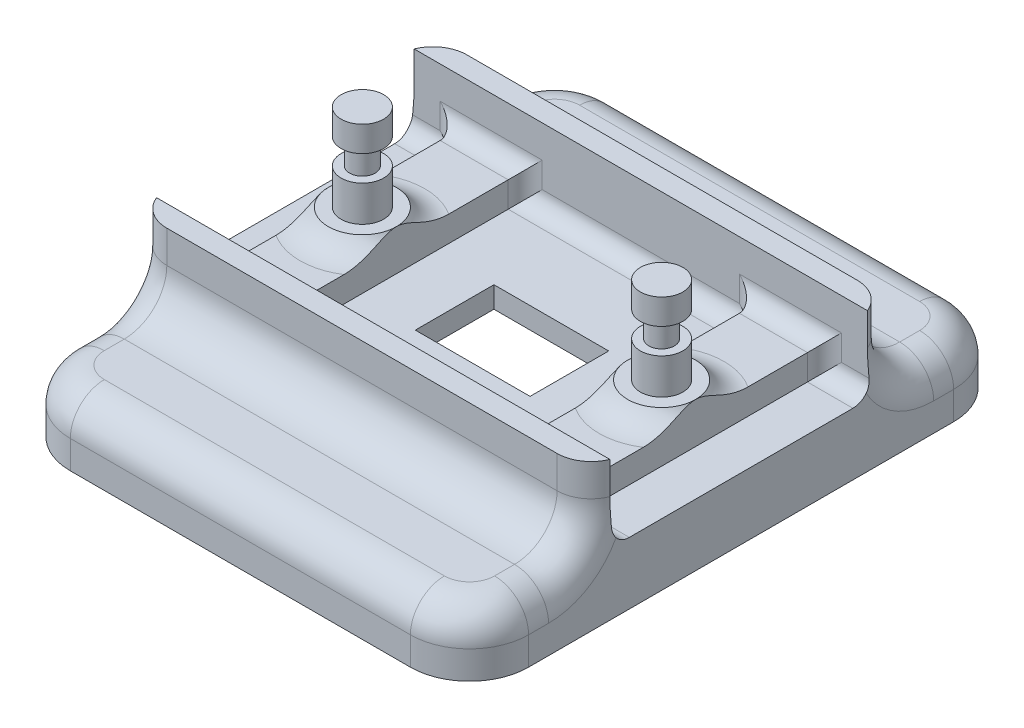
from build123d import *

# Parameters (mm, degrees)
SALIENTE_EXTRUIR1_DEPTH = 2.5
SALIENTE_EXTRUIR2_START = -4.8
SALIENTE_EXTRUIR2_DEPTH = 4.8
REDONDEO1_R             = 1
SALIENTE_EXTRUIR3_DEPTH = 8.8
CROQUIS3_3_R            = 4
CROQUIS3_3_R_2          = 1.625
SALIENTE_EXTRUIR6_DEPTH = 3
CROQUIS3_4_R            = 4
CROQUIS3_4_R_2          = 1.625
SALIENTE_EXTRUIR7_DEPTH = 4.8
REDONDEO2_R             = 2
REDONDEO3_R             = 5
REDONDEO4_R             = 4
REDONDEO5_R             = 4
CROQUIS4_R              = 2.5
SALIENTE_EXTRUIR8_DEPTH = 15
CORTAR_EXTRUIR1_START   = -6
CROQUIS5_R              = 2.5
CROQUIS5_R_2            = 1.5
CORTAR_EXTRUIR1_DEPTH   = 3
CROQUIS6_W              = 13.5
CROQUIS6_H              = 9.25
CORTAR_EXTRUIR2_DEPTH   = 45.408388908


with BuildPart() as part:
    # Croquis2 → Saliente-Extruir1 (new body)
    # profile 1 of 2: a face of its own
    with BuildSketch(Plane(origin=(0, 0, 0), x_dir=(1, 0, 0), z_dir=(0, 1, 0))):
        with BuildLine():
            Line((26.95, -25), (26.95, 25))
            ThreePointArc((26.95, 25), (24.914392129, 29.914392129), (20, 31.95))
            Line((20, 31.95), (-20, 31.95))
            ThreePointArc((-20, 31.95), (-24.914392129, 29.914392129), (-26.95, 25))
            Line((-26.95, 25), (-26.95, -25))
            ThreePointArc((-26.95, -25), (-24.914392129, -29.914392129), (-20, -31.95))
            Line((-20, -31.95), (20, -31.95))
            ThreePointArc((20, -31.95), (24.914392129, -29.914392129), (26.95, -25))
        make_face()
        with BuildLine():
            ThreePointArc((24.95, 25), (23.500178567, 28.500178567), (20, 29.95))
            Line((20, 29.95), (-20, 29.95))
            ThreePointArc((-20, 29.95), (-23.500178567, 28.500178567), (-24.95, 25))
            Line((-24.95, 25), (-24.95, -25))
            ThreePointArc((-24.95, -25), (-23.500178567, -28.500178567), (-20, -29.95))
            Line((-20, -29.95), (20, -29.95))
            ThreePointArc((20, -29.95), (23.500178567, -28.500178567), (24.95, -25))
            Line((24.95, -25), (24.95, 25))
        make_face(mode=Mode.SUBTRACT)
    # profile 2 of 2: a face of its own
    with BuildSketch(Plane(origin=(0, 0, 0), x_dir=(1, 0, 0), z_dir=(0, 1, 0))):
        with BuildLine():
            Line((24.95, -25), (24.95, 25))
            ThreePointArc((24.95, 25), (23.500178567, 28.500178567), (20, 29.95))
            Line((20, 29.95), (-20, 29.95))
            ThreePointArc((-20, 29.95), (-23.500178567, 28.500178567), (-24.95, 25))
            Line((-24.95, 25), (-24.95, -25))
            ThreePointArc((-24.95, -25), (-23.500178567, -28.500178567), (-20, -29.95))
            Line((-20, -29.95), (20, -29.95))
            ThreePointArc((20, -29.95), (23.500178567, -28.500178567), (24.95, -25))
        make_face()
    extrude(amount=SALIENTE_EXTRUIR1_DEPTH)

    # Croquis2<3> → Saliente-Extruir2 (add)
    with BuildSketch(Plane(origin=(0, 0, 0), x_dir=(1, 0, 0), z_dir=(0, 1, 0)).offset(SALIENTE_EXTRUIR2_START)):
        with BuildLine():
            Line((20, 31.95), (-20, 31.95))
            ThreePointArc((-20, 31.95), (-24.914392129, 29.914392129), (-26.95, 25))
            Line((-26.95, 25), (-26.95, -25))
            ThreePointArc((-26.95, -25), (-24.914392129, -29.914392129), (-20, -31.95))
            Line((-20, -31.95), (20, -31.95))
            ThreePointArc((20, -31.95), (24.914392129, -29.914392129), (26.95, -25))
            Line((26.95, -25), (26.95, 25))
            ThreePointArc((26.95, 25), (24.914392129, 29.914392129), (20, 31.95))
        make_face()
        with BuildLine():
            Line((20, 29.95), (-20, 29.95))
            ThreePointArc((-20, 29.95), (-23.500178567, 28.500178567), (-24.95, 25))
            Line((-24.95, 25), (-24.95, -25))
            ThreePointArc((-24.95, -25), (-23.500178567, -28.500178567), (-20, -29.95))
            Line((-20, -29.95), (20, -29.95))
            ThreePointArc((20, -29.95), (23.500178567, -28.500178567), (24.95, -25))
            Line((24.95, -25), (24.95, 25))
            ThreePointArc((24.95, 25), (23.500178567, 28.500178567), (20, 29.95))
        make_face(mode=Mode.SUBTRACT)
    extrude(amount=SALIENTE_EXTRUIR2_DEPTH)

    # Redondeo1
    redondeo1_edges = [part.edges().sort_by_distance(p)[0] for p in [
        (23.500178567, 0, -28.500178567),
        (24.95, 0, 0),
        (23.500178567, 0, 28.500178567),
        (0, 0, 29.95),
        (-23.500178567, 0, 28.500178567),
        (-24.95, 0, 0),
        (-23.500178567, 0, -28.500178567),
        (0, 0, -29.95),
    ]]
    fillet(redondeo1_edges, radius=REDONDEO1_R)

    # Croquis3 → Saliente-Extruir3 (add)
    with BuildSketch(Plane(origin=(0, 2.5, 0), x_dir=(1, 0, 0), z_dir=(0, 1, 0))):
        Polygon((-26.95, 17.65), (-26.95, 15.15), (-21.6, 15.15), (-13.6, 15.15), (13.6, 15.15), (21.6, 15.15), (26.95, 15.15), (26.95, 17.65), align=None)
        Polygon((-21.6, -15.15), (-26.95, -15.15), (-26.95, -17.65), (26.95, -17.65), (26.95, -15.15), (21.6, -15.15), (13.6, -15.15), (-13.6, -15.15), align=None)
    extrude(amount=SALIENTE_EXTRUIR3_DEPTH)

    # Croquis3<3> → Saliente-Extruir6 (add)
    # profile 1 of 6: a face of its own
    with BuildSketch(Plane(origin=(0, 2.5, 0), x_dir=(1, 0, 0), z_dir=(0, 1, 0))):
        with BuildLine():
            Line((-13.6, 15.15), (-21.6, 15.15))
            Line((-21.6, 15.15), (-21.6, -2.7e-08))
            ThreePointArc((-21.6, -2.7e-08), (-17.600000014, 4), (-13.6, 0))
            Line((-13.6, 0), (-13.6, 15.15))
        make_face()
    # profile 2 of 6: a face of its own
    with BuildSketch(Plane(origin=(0, 2.5, 0), x_dir=(1, 0, 0), z_dir=(0, 1, 0))):
        with BuildLine():
            Line((21.6, 15.15), (13.6, 15.15))
            Line((13.6, 15.15), (13.6, 0))
            ThreePointArc((13.6, 0), (17.6, 4), (21.6, 0))
            Line((21.6, 0), (21.6, 15.15))
        make_face()
    # profile 3 of 6: a face of its own
    with BuildSketch(Plane(origin=(0, 2.5, 0), x_dir=(1, 0, 0), z_dir=(0, 1, 0))):
        with BuildLine():
            ThreePointArc((21.6, 0), (17.6, -4), (13.6, 0))
            Line((13.6, 0), (13.6, -15.15))
            Line((13.6, -15.15), (21.6, -15.15))
            Line((21.6, -15.15), (21.6, 0))
        make_face()
    # profile 4 of 6: a face of its own
    with BuildSketch(Plane(origin=(0, 2.5, 0), x_dir=(1, 0, 0), z_dir=(0, 1, 0))):
        with BuildLine():
            ThreePointArc((-13.6, 0), (-17.599999986, -4), (-21.6, -2.7e-08))
            Line((-21.6, -2.7e-08), (-21.6, -15.15))
            Line((-21.6, -15.15), (-13.6, -15.15))
            Line((-13.6, -15.15), (-13.6, 0))
        make_face()
    # profile 5 of 6: a face of its own
    with BuildSketch(Plane(origin=(0, 2.5, 0), x_dir=(1, 0, 0), z_dir=(0, 1, 0))):
        with Locations((-17.6, 0)):
            Circle(CROQUIS3_3_R)
        with Locations(Location((-17.6, 0, 0), (0, 0, 270))):
            Circle(CROQUIS3_3_R_2, mode=Mode.SUBTRACT)
    # profile 6 of 6: a face of its own
    with BuildSketch(Plane(origin=(0, 2.5, 0), x_dir=(1, 0, 0), z_dir=(0, 1, 0))):
        with Locations((17.6, 0)):
            Circle(CROQUIS3_3_R)
        with Locations(Location((17.6, 0, 0), (0, 0, 270))):
            Circle(CROQUIS3_3_R_2, mode=Mode.SUBTRACT)
    extrude(amount=SALIENTE_EXTRUIR6_DEPTH)

    # Croquis3<4> → Saliente-Extruir7 (add)
    # profile 1 of 2: a face of its own
    with BuildSketch(Plane(origin=(0, 2.5, 0), x_dir=(1, 0, 0), z_dir=(0, 1, 0))):
        with Locations(Location((-17.6, 0, 0), (0, 0, 180))):
            Circle(CROQUIS3_4_R)
        with Locations(Location((-17.6, 0, 0), (0, 0, 270))):
            Circle(CROQUIS3_4_R_2, mode=Mode.SUBTRACT)
    # profile 2 of 2: a face of its own
    with BuildSketch(Plane(origin=(0, 2.5, 0), x_dir=(1, 0, 0), z_dir=(0, 1, 0))):
        with Locations((17.6, 0)):
            Circle(CROQUIS3_4_R)
        with Locations(Location((17.6, 0, 0), (0, 0, 270))):
            Circle(CROQUIS3_4_R_2, mode=Mode.SUBTRACT)
    extrude(amount=SALIENTE_EXTRUIR7_DEPTH)

    # Redondeo2
    redondeo2_edges = [part.edges().sort_by_distance(p)[0] for p in [
        (-24.275, 2.5, -15.15),
        (-24.275, 2.5, 15.15),
        (0, 2.5, 15.15),
        (0, 2.5, -15.15),
        (-21.6, 4, -15.15),
        (-21.6, 4, 15.15),
        (-13.6, 4, 15.15),
        (-17.6, 5.5, -15.15),
        (-13.6, 4, -15.15),
        (-17.6, 5.5, 15.15),
        (24.275, 2.5, 15.15),
        (24.275, 2.5, -15.15),
        (13.6, 4, -15.15),
        (13.6, 4, 15.15),
        (21.6, 4, 15.15),
        (17.6, 5.5, -15.15),
        (21.6, 4, -15.15),
        (17.6, 5.5, 15.15),
    ]]
    fillet(redondeo2_edges, radius=REDONDEO2_R)

    # Redondeo3
    redondeo3_edges = [part.edges().sort_by_distance(p)[0] for p in [
        (0, 2.5, -17.65),
        (0, 2.5, 17.65),
    ]]
    fillet(redondeo3_edges, radius=REDONDEO3_R)

    # Redondeo4
    # the kernel refuses this fillet: 4 mm, written as the material it adds along each edge
    with BuildSketch(Plane(origin=(-17.6, 5.5, 0), x_dir=(-1, 0, 0), z_dir=(0, 0, 1))) as redondeo4_piece_1_section:
        with BuildLine():
            CenterArc((7.340658618, -4), REDONDEO4_R, 90, 56.632987031)
            Line((4, -1.8), (4, 0))
            Line((4, 0), (7.340658618, 0))
        make_face()
    redondeo4_piece_1 = revolve(axis=Axis((-17.6, 5.5, 0), (0, -1, 0)), revolution_arc=180, mode=Mode.PRIVATE)
    redondeo4_piece_1 = split(redondeo4_piece_1, bisect_by=Plane(origin=(-21.6, 5.5, 0), z_dir=(1, 0, 0)), keep=Keep.TOP, mode=Mode.PRIVATE)
    redondeo4_piece_1 = split(redondeo4_piece_1, bisect_by=Plane(origin=(-13.6, 5.5, 0), z_dir=(-1, 0, 0)), keep=Keep.TOP, mode=Mode.PRIVATE)
    add(redondeo4_piece_1)
    with BuildSketch(Plane(origin=(17.6, 5.5, 0), x_dir=(-1, 0, 0), z_dir=(0, 0, 1))) as redondeo4_piece_2_section:
        with BuildLine():
            CenterArc((7.340658618, -4), REDONDEO4_R, 90, 56.632987031)
            Line((4, -1.8), (4, 0))
            Line((4, 0), (7.340658618, 0))
        make_face()
    redondeo4_piece_2 = revolve(axis=Axis((17.6, 5.5, 0), (0, -1, 0)), revolution_arc=180, mode=Mode.PRIVATE)
    redondeo4_piece_2 = split(redondeo4_piece_2, bisect_by=Plane(origin=(21.6, 5.5, 0), z_dir=(-1, 0, 0)), keep=Keep.TOP, mode=Mode.PRIVATE)
    redondeo4_piece_2 = split(redondeo4_piece_2, bisect_by=Plane(origin=(13.6, 5.5, 0), z_dir=(1, 0, 0)), keep=Keep.TOP, mode=Mode.PRIVATE)
    add(redondeo4_piece_2)
    with BuildSketch(Plane(origin=(17.6, 5.5, 0), x_dir=(1, 0, 0), z_dir=(0, 0, -1))) as redondeo4_piece_3_section:
        with BuildLine():
            CenterArc((7.340658618, -4), REDONDEO4_R, 90, 56.632987031)
            Line((4, -1.8), (4, 0))
            Line((4, 0), (7.340658618, 0))
        make_face()
    redondeo4_piece_3 = revolve(axis=Axis((17.6, 5.5, 0), (0, -1, 0)), revolution_arc=180, mode=Mode.PRIVATE)
    redondeo4_piece_3 = split(redondeo4_piece_3, bisect_by=Plane(origin=(21.6, 5.5, 0), z_dir=(-1, 0, 0)), keep=Keep.TOP, mode=Mode.PRIVATE)
    redondeo4_piece_3 = split(redondeo4_piece_3, bisect_by=Plane(origin=(13.6, 5.5, 0), z_dir=(1, 0, 0)), keep=Keep.TOP, mode=Mode.PRIVATE)
    add(redondeo4_piece_3)
    with BuildSketch(Plane(origin=(-17.6, 5.5, 0), x_dir=(1, 0, 0), z_dir=(0, 0, -1))) as redondeo4_piece_4_section:
        with BuildLine():
            CenterArc((7.340658618, -4), REDONDEO4_R, 90, 56.632987031)
            Line((4, -1.8), (4, 0))
            Line((4, 0), (7.340658618, 0))
        make_face()
    redondeo4_piece_4 = revolve(axis=Axis((-17.6, 5.5, 0), (0, -1, 0)), revolution_arc=180, mode=Mode.PRIVATE)
    redondeo4_piece_4 = split(redondeo4_piece_4, bisect_by=Plane(origin=(-21.6, 5.5, 0), z_dir=(1, 0, 0)), keep=Keep.TOP, mode=Mode.PRIVATE)
    redondeo4_piece_4 = split(redondeo4_piece_4, bisect_by=Plane(origin=(-13.6, 5.5, 0), z_dir=(-1, 0, 0)), keep=Keep.TOP, mode=Mode.PRIVATE)
    add(redondeo4_piece_4)

    # Redondeo5
    # the kernel refuses this fillet: 4 mm, written as the material it takes off along each edge
    with BuildSketch(Plane(origin=(26.95, 7.5, -17.65), x_dir=(0, 0, 1), z_dir=(0, 1, 0)), Plane(origin=(-26.95, 7.5, 17.65), x_dir=(0, 0, -1), z_dir=(0, 1, 0))) as redondeo5_piece_1:
        with BuildLine():
            CenterArc((REDONDEO5_R, -REDONDEO5_R), REDONDEO5_R, 90, 90)
            Line((0, -REDONDEO5_R), (0, 0))
            Line((0, 0), (REDONDEO5_R, 0))
        make_face()
    extrude(amount=13.8, mode=Mode.SUBTRACT)
    with BuildSketch(Plane(origin=(26.95, 7.5, -22.65), x_dir=(0, 0, 1), z_dir=(0, 1, 0))) as redondeo5_piece_2:
        with BuildLine():
            CenterArc((5 + REDONDEO5_R, -REDONDEO5_R), REDONDEO5_R, 90, 90)
            Line((5, -REDONDEO5_R), (5, 0))
            Line((5, 0), (5 + REDONDEO5_R, 0))
        make_face()
    revolve(axis=Axis((26.95, 7.5, -22.65), (1, 0, 0)), revolution_arc=90, mode=Mode.SUBTRACT)
    with BuildSketch(Plane(origin=(26.95, 2.5, -22.65), x_dir=(0, -1, 0), z_dir=(0, 0, -1)), Plane(origin=(-26.95, 2.5, -25), x_dir=(0, -1, 0), z_dir=(0, 0, 1)), Plane(origin=(-26.95, 2.5, 22.65), x_dir=(0, -1, 0), z_dir=(0, 0, 1)), Plane(origin=(26.95, 2.5, 25), x_dir=(0, -1, 0), z_dir=(0, 0, -1))) as redondeo5_piece_3:
        with BuildLine():
            CenterArc((REDONDEO5_R, REDONDEO5_R), REDONDEO5_R, 180, 90)
            Line((0, REDONDEO5_R), (0, 0))
            Line((0, 0), (REDONDEO5_R, 0))
        make_face()
    extrude(amount=2.35, mode=Mode.SUBTRACT)
    with BuildSketch(Plane(origin=(-26.95, 7.5, -17.65), x_dir=(0, 0, 1), z_dir=(0, 1, 0)), Plane(origin=(26.95, 7.5, 17.65), x_dir=(0, 0, -1), z_dir=(0, 1, 0))) as redondeo5_piece_4:
        with BuildLine():
            CenterArc((REDONDEO5_R, REDONDEO5_R), REDONDEO5_R, 180, 90)
            Line((0, REDONDEO5_R), (0, 0))
            Line((0, 0), (REDONDEO5_R, 0))
        make_face()
    extrude(amount=13.8, mode=Mode.SUBTRACT)
    with BuildSketch(Plane(origin=(-26.95, 7.5, -22.65), x_dir=(0, 0, 1), z_dir=(0, 1, 0))) as redondeo5_piece_5:
        with BuildLine():
            CenterArc((5 + REDONDEO5_R, REDONDEO5_R), REDONDEO5_R, 180, 90)
            Line((5, REDONDEO5_R), (5, 0))
            Line((5, 0), (5 + REDONDEO5_R, 0))
        make_face()
    revolve(axis=Axis((-26.95, 7.5, -22.65), (1, 0, 0)), revolution_arc=90, mode=Mode.SUBTRACT)
    with BuildSketch(Plane(origin=(-20, 2.5, -25), x_dir=(0, 0, -1), z_dir=(1, 0, 0))) as redondeo5_piece_6:
        with BuildLine():
            CenterArc((6.95 - REDONDEO5_R, -REDONDEO5_R), REDONDEO5_R, 0, 90)
            Line((6.95, -REDONDEO5_R), (6.95, 0))
            Line((6.95, 0), (6.95 - REDONDEO5_R, 0))
        make_face()
    revolve(axis=Axis((-20, 2.5, -25), (0, 1, 0)), revolution_arc=90, mode=Mode.SUBTRACT)
    with BuildSketch(Plane(origin=(20, 2.5, -31.95), x_dir=(0, 0, 1), z_dir=(-1, 0, 0)), Plane(origin=(-20, 2.5, 31.95), x_dir=(0, 0, -1), z_dir=(1, 0, 0))) as redondeo5_piece_7:
        with BuildLine():
            CenterArc((REDONDEO5_R, -REDONDEO5_R), REDONDEO5_R, 90, 90)
            Line((0, -REDONDEO5_R), (0, 0))
            Line((0, 0), (REDONDEO5_R, 0))
        make_face()
    extrude(amount=40, mode=Mode.SUBTRACT)
    with BuildSketch(Plane(origin=(-26.95, 7.5, 22.65), x_dir=(0, 0, -1), z_dir=(0, 1, 0))) as redondeo5_piece_8:
        with BuildLine():
            CenterArc((5 + REDONDEO5_R, -REDONDEO5_R), REDONDEO5_R, 90, 90)
            Line((5, -REDONDEO5_R), (5, 0))
            Line((5, 0), (5 + REDONDEO5_R, 0))
        make_face()
    revolve(axis=Axis((-26.95, 7.5, 22.65), (-1, 0, 0)), revolution_arc=90, mode=Mode.SUBTRACT)
    with BuildSketch(Plane(origin=(-20, 2.5, 25), x_dir=(-1, 0, 0), z_dir=(0, 0, -1))) as redondeo5_piece_9:
        with BuildLine():
            CenterArc((6.95 - REDONDEO5_R, -REDONDEO5_R), REDONDEO5_R, 0, 90)
            Line((6.95 - REDONDEO5_R, 0), (6.95, 0))
            Line((6.95, 0), (6.95, -REDONDEO5_R))
        make_face()
    revolve(axis=Axis((-20, 2.5, 25), (0, 1, 0)), revolution_arc=90, mode=Mode.SUBTRACT)
    with BuildSketch(Plane(origin=(26.95, 7.5, 22.65), x_dir=(0, 0, -1), z_dir=(0, 1, 0))) as redondeo5_piece_10:
        with BuildLine():
            CenterArc((5 + REDONDEO5_R, REDONDEO5_R), REDONDEO5_R, 180, 90)
            Line((5, REDONDEO5_R), (5, 0))
            Line((5, 0), (5 + REDONDEO5_R, 0))
        make_face()
    revolve(axis=Axis((26.95, 7.5, 22.65), (-1, 0, 0)), revolution_arc=90, mode=Mode.SUBTRACT)
    with BuildSketch(Plane(origin=(20, 2.5, -25), x_dir=(1, 0, 0), z_dir=(0, 0, 1))) as redondeo5_piece_11:
        with BuildLine():
            CenterArc((6.95 - REDONDEO5_R, -REDONDEO5_R), REDONDEO5_R, 0, 90)
            Line((6.95, -REDONDEO5_R), (6.95, 0))
            Line((6.95, 0), (6.95 - REDONDEO5_R, 0))
        make_face()
    revolve(axis=Axis((20, 2.5, -25), (0, 1, 0)), revolution_arc=90, mode=Mode.SUBTRACT)
    with BuildSketch(Plane(origin=(20, 2.5, 25), x_dir=(0, 0, 1), z_dir=(-1, 0, 0))) as redondeo5_piece_12:
        with BuildLine():
            CenterArc((6.95 - REDONDEO5_R, -REDONDEO5_R), REDONDEO5_R, 0, 90)
            Line((6.95, -REDONDEO5_R), (6.95, 0))
            Line((6.95, 0), (6.95 - REDONDEO5_R, 0))
        make_face()
    revolve(axis=Axis((20, 2.5, 25), (0, 1, 0)), revolution_arc=90, mode=Mode.SUBTRACT)

    # Croquis4 → Saliente-Extruir8 (add)
    with BuildSketch(Plane(origin=(0, 2.5, 0), x_dir=(1, 0, 0), z_dir=(0, 1, 0))):
        with Locations(Location((-17.6, 0, 0), (0, 0, 270))):
            Circle(CROQUIS4_R)
        with Locations(Location((17.6, 0, 0), (0, 0, 270))):
            Circle(CROQUIS4_R)
    extrude(amount=SALIENTE_EXTRUIR8_DEPTH)

    # Croquis5 → Cortar-Extruir1 (cut)
    # profile 1 of 2: a face of its own
    with BuildSketch(Plane(origin=(0, 17.5, 0), x_dir=(1, 0, 0), z_dir=(0, 1, 0)).offset(CORTAR_EXTRUIR1_START)):
        with Locations(Location((17.6, 0, 0), (0, 0, 270))):
            Circle(CROQUIS5_R)
        with Locations(Location((17.6, 0, 0), (0, 0, 270))):
            Circle(CROQUIS5_R_2, mode=Mode.SUBTRACT)
    # profile 2 of 2: a face of its own
    with BuildSketch(Plane(origin=(0, 17.5, 0), x_dir=(1, 0, 0), z_dir=(0, 1, 0)).offset(CORTAR_EXTRUIR1_START)):
        with Locations(Location((-17.6, 0, 0), (0, 0, 270))):
            Circle(CROQUIS5_R)
        with Locations(Location((-17.6, 0, 0), (0, 0, 270))):
            Circle(CROQUIS5_R_2, mode=Mode.SUBTRACT)
    extrude(amount=CORTAR_EXTRUIR1_DEPTH, mode=Mode.SUBTRACT)

    # Croquis6 → Cortar-Extruir2 (cut, through all)
    with BuildSketch(Plane(origin=(0, 2.5, 0), x_dir=(1, 0, 0), z_dir=(0, 1, 0))):
        Rectangle(CROQUIS6_W, CROQUIS6_H)
    extrude(amount=-CORTAR_EXTRUIR2_DEPTH, mode=Mode.SUBTRACT)


solid = part.part
